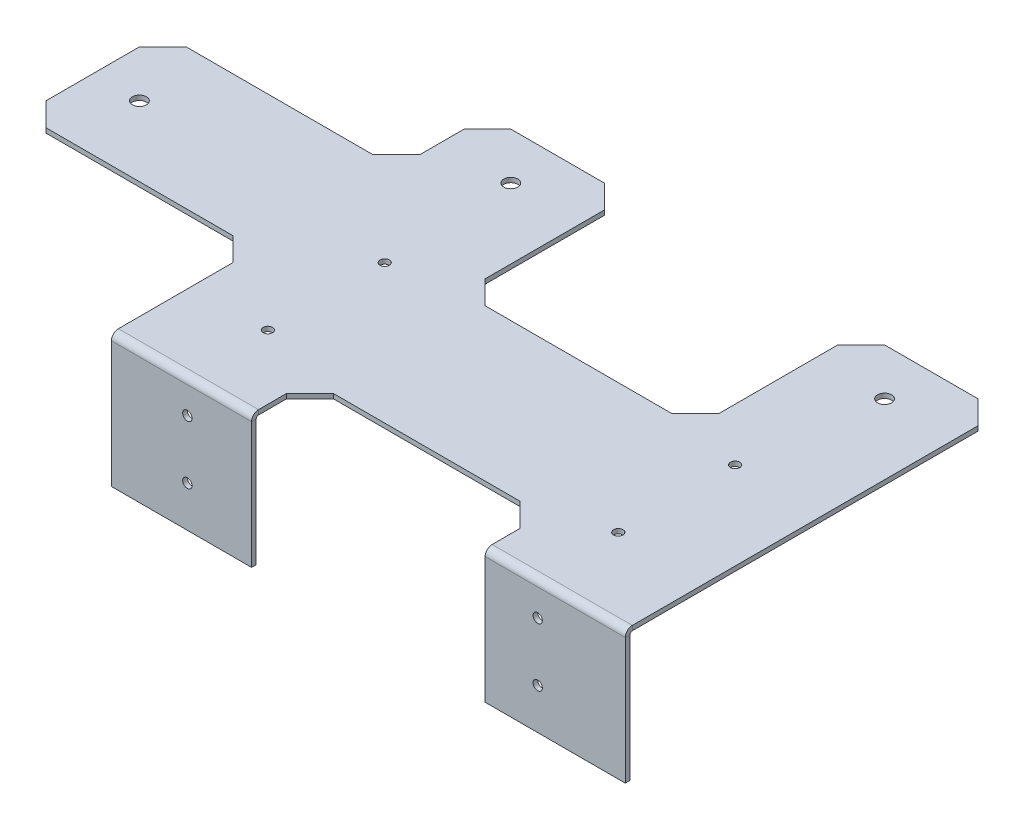
from build123d import *

# Parameters (mm, degrees)
SM_BASE_FLANGE_1_DEPTH            = 2
SM_EDGE_FLANGE_2_STRIP_W          = 10
SM_EDGE_FLANGE_2_STRIP_H          = 2
SM_EDGE_FLANGE_2_STRIP_CUT_DEPTH  = 220
SM_EDGE_FLANGE_2_RELIEF_W         = 11
SM_EDGE_FLANGE_2_RELIEF_H         = 1
SM_EDGE_FLANGE_2_RELIEF_CUT_DEPTH = 2
SM_EDGE_FLANGE_2_DEPTH            = 220
CUT_EXTRUDE_START                 = 62
SKETCH_12_R                       = 2
CUT_EXTRUDE_4_DEPTH               = 2
SKETCH_14_R                       = 2
CUT_EXTRUDE_2_DEPTH               = 2
SKETCH_15_W                       = 100
SKETCH_15_H                       = 25
CUT_EXTRUDE_3_DEPTH               = 57
SKETCH_16_W                       = 100
SKETCH_16_H                       = 60
CUT_EXTRUDE_6_DEPTH               = 2
CUT_EXTRUDE_START_2               = -2
SKETCH_18_R                       = 3
CUT_EXTRUDE_7_DEPTH               = 2
OTHER_START                       = -2
OTHER_2_DEPTH                     = 2
SKETCH_20_W                       = 60
SKETCH_20_H                       = 61
CUT_EXTRUDE_8_DEPTH               = 2
SKETCH_21_R                       = 3
CUT_EXTRUDE_9_DEPTH               = 2
OTHER_4_DEPTH                     = 2
OTHER_4_2_DEPTH                   = 2


# Read off the part's stored shape, not the designer's step: 断开-边角2, 断开-边角4
# Sheet-metal steps are written as plain solids
with BuildPart() as part:
    # Sketch 1 → 基体-法兰1 (new body)
    with BuildSketch(Plane(origin=(0, 0, 0), x_dir=(1, 0, 0), z_dir=(0, 1, 0))):
        Polygon((-110, -60), (110, -60), (110, 60), (110, 160), (-110, 160), (-110, 60), (-210, 60), (-210, -60), align=None)
    extrude(amount=-SM_BASE_FLANGE_1_DEPTH)

    # 边线-法兰2 strip (across the edge) → 边线-法兰2 strip cut (cut)
    with BuildSketch(Plane(origin=(110, -2, 60), x_dir=(0, 0, -1), z_dir=(-1, 0, 0))):
        with Locations((-4, -1)):
            Rectangle(SM_EDGE_FLANGE_2_STRIP_W, SM_EDGE_FLANGE_2_STRIP_H)
    extrude(amount=SM_EDGE_FLANGE_2_STRIP_CUT_DEPTH, mode=Mode.SUBTRACT)

    # 边线-法兰2 relief (on the sheet) → 边线-法兰2 relief cut (cut)
    with BuildSketch(Plane(origin=(110, -2, 59), x_dir=(0, 0, -1), z_dir=(0, -1, 0))):
        with Locations((-4.5, -220.5)):
            Rectangle(SM_EDGE_FLANGE_2_RELIEF_W, SM_EDGE_FLANGE_2_RELIEF_H)
    extrude(amount=-SM_EDGE_FLANGE_2_RELIEF_CUT_DEPTH, mode=Mode.SUBTRACT)

    # 边线-法兰2 section (across the edge) → 边线-法兰2 (add)
    with BuildSketch(Plane(origin=(110, -2, 60), x_dir=(0, 0, -1), z_dir=(-1, 0, 0))):
        with BuildLine():
            Line((-2, 1), (-2, 55))
            Line((-2, 55), (0, 55))
            Line((0, 55), (0, 1))
            ThreePointArc((0, 1), (0.292893219, 0.292893219), (1, 0))
            Line((1, 0), (1, -2))
            ThreePointArc((1, -2), (-1.121320344, -1.121320344), (-2, 1))
        make_face()
    extrude(amount=SM_EDGE_FLANGE_2_DEPTH)

    # 草图12 → 切除-拉伸4 (cut)
    with BuildSketch(Plane.XY.offset(CUT_EXTRUDE_START)):
        with Locations(Location((72.5, -14.5, 0), (0, 0, 90))):
            Circle(SKETCH_12_R)
        with Locations(Location((-77.5, -14.5, 0), (0, 0, 90))):
            Circle(SKETCH_12_R)
        with Locations(Location((-77.5, -39.5, 0), (0, 0, 90))):
            Circle(SKETCH_12_R)
        with Locations(Location((72.5, -39.5, 0), (0, 0, 90))):
            Circle(SKETCH_12_R)
    extrude(amount=-CUT_EXTRUDE_4_DEPTH, mode=Mode.SUBTRACT)

    # 草图14 → 切除-拉伸2 (cut)
    with BuildSketch(Plane(origin=(0, 0, 0), x_dir=(1, 0, 0), z_dir=(0, 1, 0))):
        with Locations(Location((-77.5, 22.5, 0), (0, 0, 270))):
            Circle(SKETCH_14_R)
        with Locations(Location((-77.5, -27.5, 0), (0, 0, 270))):
            Circle(SKETCH_14_R)
        with Locations(Location((72.5, 22.5, 0), (0, 0, 270))):
            Circle(SKETCH_14_R)
        with Locations(Location((72.5, -27.5, 0), (0, 0, 270))):
            Circle(SKETCH_14_R)
    extrude(amount=-CUT_EXTRUDE_2_DEPTH, mode=Mode.SUBTRACT)

    # 草图15 → 切除-拉伸3 (cut)
    with BuildSketch(Plane(origin=(0, 0, 0), x_dir=(1, 0, 0), z_dir=(0, 1, 0))):
        with Locations((0, -49.5)):
            Rectangle(SKETCH_15_W, SKETCH_15_H)
        Polygon((-50, 53), (-50, 28), (50, 28), (50, 53), (50, 160), (-50, 160), align=None)
    extrude(amount=-CUT_EXTRUDE_3_DEPTH, mode=Mode.SUBTRACT)

    # 草图16 → 切除-拉伸6 (cut)
    with BuildSketch(Plane(origin=(0, 0, 0), x_dir=(1, 0, 0), z_dir=(0, 1, 0))):
        with Locations((-160, -30)):
            Rectangle(SKETCH_16_W, SKETCH_16_H)
    extrude(amount=-CUT_EXTRUDE_6_DEPTH, mode=Mode.SUBTRACT)

    # 草图18 → 切除-拉伸7 (cut)
    with BuildSketch(Plane(origin=(0, 0, 0), x_dir=(1, 0, 0), z_dir=(0, 1, 0)).offset(CUT_EXTRUDE_START_2)):
        with Locations(Location((-80, 140, 0), (0, 0, 270))):
            Circle(SKETCH_18_R)
        with Locations(Location((80, 140, 0), (0, 0, 270))):
            Circle(SKETCH_18_R)
        with Locations(Location((-190, 30, 0), (0, 0, 270))):
            Circle(SKETCH_18_R)
    extrude(amount=CUT_EXTRUDE_7_DEPTH, mode=Mode.SUBTRACT)

    # Other 2 outline → Other 2 (add)
    with BuildSketch(Plane(origin=(0, 0, 0), x_dir=(1, 0, 0), z_dir=(0, 1, 0)).offset(OTHER_START)):
        Polygon((-50, -37), (-50, -47), (-40, -37), align=None)
        Polygon((50, -37), (40, -37), (50, -47), align=None)
        Polygon((50, 28), (50, 38), (40, 28), align=None)
        Polygon((-50, 28), (-40, 28), (-50, 38), align=None)
    extrude(amount=OTHER_2_DEPTH)

    # 草图20 → 切除-拉伸8 (cut)
    with BuildSketch(Plane(origin=(0, 0, 0), x_dir=(1, 0, 0), z_dir=(0, 1, 0))):
        with Locations((-80, 129.5)):
            Rectangle(SKETCH_20_W, SKETCH_20_H)
        with Locations((80, 129.5)):
            Rectangle(SKETCH_20_W, SKETCH_20_H)
    extrude(amount=-CUT_EXTRUDE_8_DEPTH, mode=Mode.SUBTRACT)

    # 草图21 → 切除-拉伸9 (cut)
    with BuildSketch(Plane(origin=(0, 0, 0), x_dir=(1, 0, 0), z_dir=(0, 1, 0))):
        with Locations(Location((-80, 79, 0), (0, 0, 270))):
            Circle(SKETCH_21_R)
        with Locations(Location((80, 79, 0), (0, 0, 270))):
            Circle(SKETCH_21_R)
    extrude(amount=-CUT_EXTRUDE_9_DEPTH, mode=Mode.SUBTRACT)

    # Other 4 outline → Other 4 (cut)
    with BuildSketch(Plane(origin=(0, 0, 0), x_dir=(1, 0, 0), z_dir=(0, 1, 0)).offset(OTHER_START)):
        Polygon((-50, 99), (-60, 99), (-50, 89), align=None)
        Polygon((-200, 0), (-210, 10), (-210, 0), align=None)
        Polygon((-210, 50), (-200, 60), (-210, 60), align=None)
        Polygon((-110, 89), (-100, 99), (-110, 99), align=None)
        Polygon((50, 99), (50, 89), (60, 99), align=None)
        Polygon((110, 99), (100, 99), (110, 89), align=None)
    extrude(amount=OTHER_4_DEPTH, mode=Mode.SUBTRACT)

    # Other 4 2 outline → Other 4 2 (add)
    with BuildSketch(Plane(origin=(0, 0, 0), x_dir=(1, 0, 0), z_dir=(0, 1, 0)).offset(OTHER_START)):
        Polygon((-110, 0), (-120, 0), (-110, -10), align=None)
        Polygon((-110, 60), (-110, 70), (-120, 60), align=None)
    extrude(amount=OTHER_4_2_DEPTH)


solid = part.part
